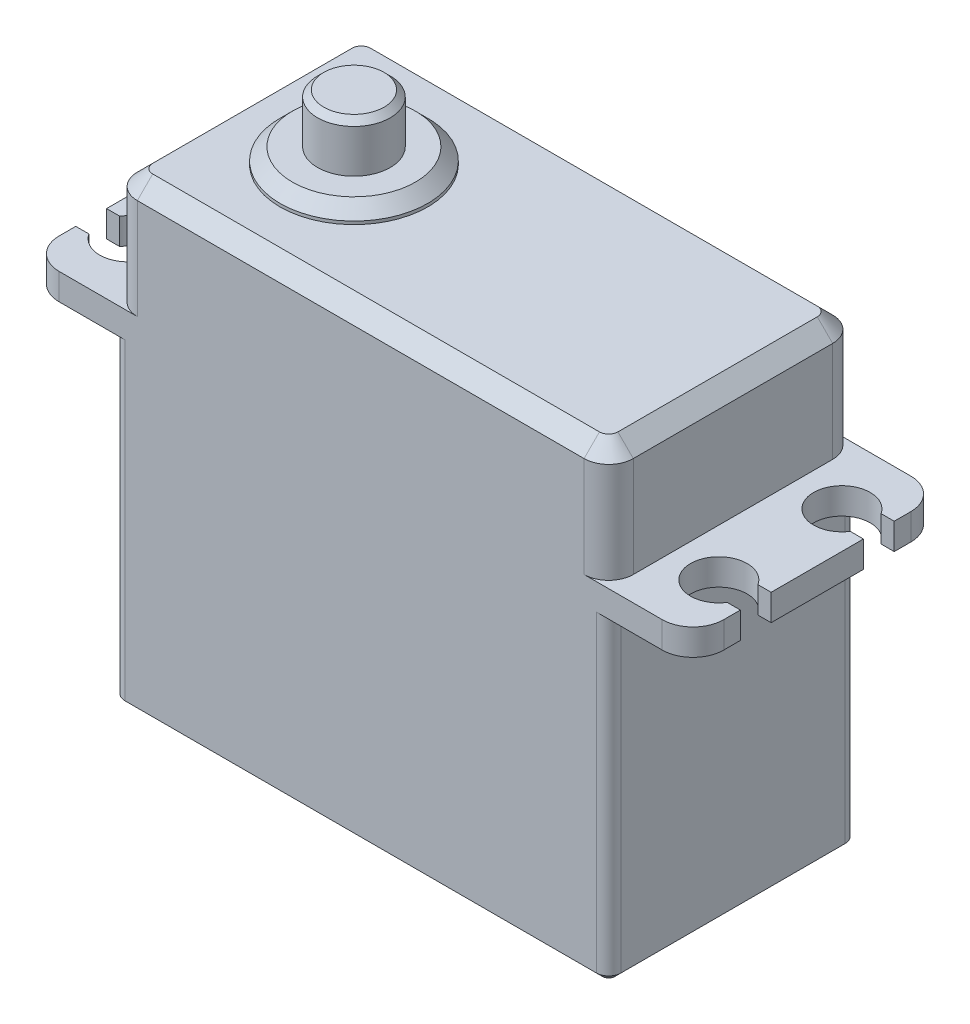
from build123d import *

# Parameters (mm, degrees)
SKETCH2_W            = 40.3
SKETCH2_H            = 20.2
BOSS_EXTRUDE1_DEPTH  = 12.95
FILLET1_R            = 1
SKETCH3_W            = 54
SKETCH3_H            = 20.2
BOSS_EXTRUDE2_DEPTH  = 2.14
FILLET2_R            = 2.5
SKETCH4_W            = 40.3
SKETCH4_H            = 20.2
BOSS_EXTRUDE3_DEPTH  = 9.41
FILLET3_R            = 2
CHAMFER1_SIZE        = 1.25
SKETCH5_R            = 6
BOSS_EXTRUDE4_DEPTH  = 1.25
CHAMFER2_SIZE        = 1
SKETCH6_R            = 2.95
BOSS_EXTRUDE5_DEPTH  = 4
CHAMFER3_SIZE        = 0.5
CUT_EXTRUDE1_DEPTH   = 41.215066828
LPATTERN1_COUNT      = 2
LPATTERN1_PITCH      = 10
MIRROR1_COPY_1_DEPTH = 41.215066828
MIRROR1_COPY_2_DEPTH = 41.215066828
CHAMFER4_SIZE        = 0.5


with BuildPart() as part:
    # Sketch2 → Boss-Extrude1 (new, symmetric)
    with BuildSketch(Plane(origin=(0, 0, 0), x_dir=(1, 0, 0), z_dir=(0, 1, 0))):
        Rectangle(SKETCH2_W, SKETCH2_H)
    extrude(amount=BOSS_EXTRUDE1_DEPTH, both=True)

    # Fillet1
    fillet1_edges = [part.edges().sort_by_distance(p)[0] for p in [
        (-20.15, 0, -10.1),
        (20.15, 0, -10.1),
        (20.15, 0, 10.1),
        (-20.15, 0, 10.1),
    ]]
    fillet(fillet1_edges, radius=FILLET1_R)

    # Sketch3 → Boss-Extrude2 (add)
    with BuildSketch(Plane(origin=(0, 12.95, 0), x_dir=(1, 0, 0), z_dir=(0, 1, 0))):
        Rectangle(SKETCH3_W, SKETCH3_H)
    extrude(amount=BOSS_EXTRUDE2_DEPTH)

    # Fillet2
    fillet2_edges = [part.edges().sort_by_distance(p)[0] for p in [
        (-27, 14.02, -10.1),
        (27, 14.02, -10.1),
        (27, 14.02, 10.1),
        (-27, 14.02, 10.1),
    ]]
    fillet(fillet2_edges, radius=FILLET2_R)

    # Sketch4 → Boss-Extrude3 (add)
    with BuildSketch(Plane(origin=(0, 15.09, 0), x_dir=(1, 0, 0), z_dir=(0, 1, 0))):
        Rectangle(SKETCH4_W, SKETCH4_H)
    extrude(amount=BOSS_EXTRUDE3_DEPTH)

    # Fillet3
    fillet3_edges = [part.edges().sort_by_distance(p)[0] for p in [
        (20.15, 19.795, -10.1),
        (20.15, 19.795, 10.1),
        (-20.15, 19.795, -10.1),
        (-20.15, 19.795, 10.1),
    ]]
    fillet(fillet3_edges, radius=FILLET3_R)

    # Chamfer1
    chamfer1_edges = [part.edges().sort_by_distance(p)[0] for p in [
        (-19.564213562, 24.5, 9.514213562),
        (-19.564213562, 24.5, -9.514213562),
        (19.564213562, 24.5, -9.514213562),
        (19.564213562, 24.5, 9.514213562),
        (20.15, 24.5, 0),
        (-20.15, 24.5, 0),
        (0, 24.5, -10.1),
        (0, 24.5, 10.1),
    ]]
    chamfer(chamfer1_edges, length=CHAMFER1_SIZE)

    # Sketch5 → Boss-Extrude4 (add)
    with BuildSketch(Plane(origin=(0, 24.5, 0), x_dir=(1, 0, 0), z_dir=(0, 1, 0))):
        with Locations((-10.65, 0)):
            Circle(SKETCH5_R)
    extrude(amount=BOSS_EXTRUDE4_DEPTH)

    # Chamfer2
    chamfer2_edges = [part.edges().sort_by_distance(p)[0] for p in [
        (-16.65, 25.75, 0),
    ]]
    chamfer(chamfer2_edges, length=CHAMFER2_SIZE)

    # Sketch6 → Boss-Extrude5 (add)
    with BuildSketch(Plane(origin=(0, 25.75, 0), x_dir=(1, 0, 0), z_dir=(0, 1, 0))):
        with Locations((-10.65, 0)):
            Circle(SKETCH6_R)
    extrude(amount=BOSS_EXTRUDE5_DEPTH)

    # Chamfer3
    chamfer3_edges = [part.edges().sort_by_distance(p)[0] for p in [
        (-13.6, 29.75, 0),
    ]]
    chamfer(chamfer3_edges, length=CHAMFER3_SIZE)

    # Sketch7 → Cut-Extrude1 (cut, symmetric)
    with BuildSketch(Plane(origin=(0, 15.09, 0), x_dir=(1, 0, 0), z_dir=(0, 1, 0))):
        with BuildLine():
            Line((-27, 6.25), (-25.930673458, 6.25))
            ThreePointArc((-25.930673458, 6.25), (-21.7, 5), (-25.930673458, 3.75))
            Line((-25.930673458, 3.75), (-27, 3.75))
            Line((-27, 3.75), (-27, 6.25))
        make_face()
    cut_extrude1 = extrude(amount=CUT_EXTRUDE1_DEPTH, both=True, mode=Mode.SUBTRACT)

    # LPattern1: Cut-Extrude1 ×2
    with Locations(*[(0, 0, i * LPATTERN1_PITCH) for i in range(1, LPATTERN1_COUNT)]):
        add(cut_extrude1, mode=Mode.SUBTRACT)

    # Mirror1 copy 1 sketch → Mirror1 copy 1 (cut, symmetric)
    with BuildSketch(Plane(origin=(0, 15.09, 10), x_dir=(-1, 0, 0), z_dir=(0, 1, 0))):
        with BuildLine():
            Line((-27, -6.25), (-25.930673458, -6.25))
            ThreePointArc((-25.930673458, -6.25), (-21.7, -5), (-25.930673458, -3.75))
            Line((-25.930673458, -3.75), (-27, -3.75))
            Line((-27, -3.75), (-27, -6.25))
        make_face()
    extrude(amount=MIRROR1_COPY_1_DEPTH, both=True, mode=Mode.SUBTRACT)

    # Mirror1 copy 2 sketch → Mirror1 copy 2 (cut, symmetric)
    with BuildSketch(Plane(origin=(0, 15.09, 0), x_dir=(-1, 0, 0), z_dir=(0, 1, 0))):
        with BuildLine():
            Line((-27, -6.25), (-25.930673458, -6.25))
            ThreePointArc((-25.930673458, -6.25), (-21.7, -5), (-25.930673458, -3.75))
            Line((-25.930673458, -3.75), (-27, -3.75))
            Line((-27, -3.75), (-27, -6.25))
        make_face()
    extrude(amount=MIRROR1_COPY_2_DEPTH, both=True, mode=Mode.SUBTRACT)

    # Chamfer4
    chamfer4_edges = [part.edges().sort_by_distance(p)[0] for p in [
        (0, -12.95, -10.1),
        (-19.857106781, -12.95, -9.807106781),
        (19.857106781, -12.95, -9.807106781),
        (-20.15, -12.95, 0),
        (20.15, -12.95, 0),
        (-19.857106781, -12.95, 9.807106781),
        (19.857106781, -12.95, 9.807106781),
        (0, -12.95, 10.1),
    ]]
    chamfer(chamfer4_edges, length=CHAMFER4_SIZE)


solid = part.part
